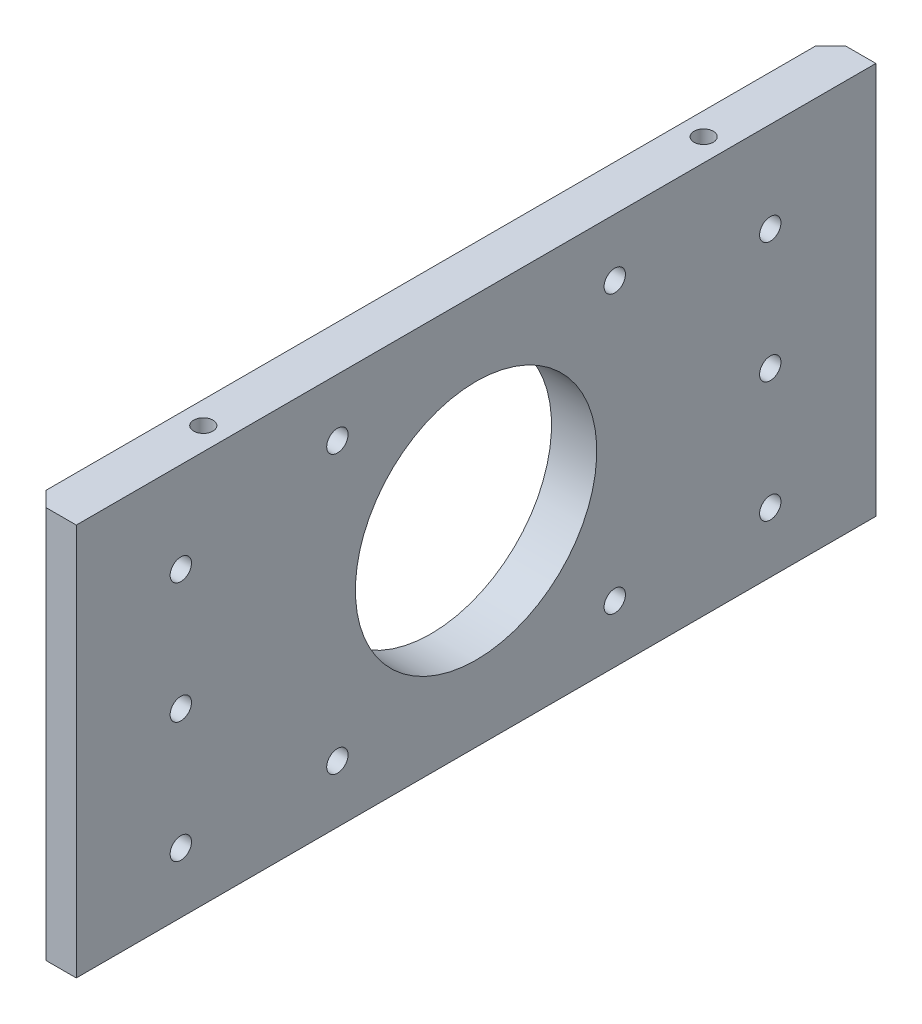
from build123d import *

# Parameters (mm, degrees)
SKETCH1_W                  = 9.525
SKETCH1_H                  = 82.55
BOSS_EXTRUDE1_DEPTH        = 168.275
F_8_CLEARANCE_HOLE1_D      = 4.4958
F_8_CLEARANCE_HOLE2_D      = 4.4958
SKETCH6_R                  = 25.4
CUT_EXTRUDE1_DEPTH         = 174.524715459
CIRPATTERN1_COUNT          = 4
CHAMFER1_SIZE              = 3.175
F_10_32_TAPPED_HOLE3_D     = 4.0386
F_10_32_TAPPED_HOLE3_DEPTH = 12.7
F_10_32_TAPPED_HOLE3_TIP   = 1.213317848
F_10_32_TAPPED_HOLE4_D     = 4.0386
F_10_32_TAPPED_HOLE4_DEPTH = 12.7
F_10_32_TAPPED_HOLE4_TIP   = 1.213317848


with BuildPart() as part:
    # Sketch1 → Boss-Extrude1 (new body)
    with BuildSketch(Plane.XY):
        Rectangle(SKETCH1_W, SKETCH1_H)
    extrude(amount=BOSS_EXTRUDE1_DEPTH)

    # #8 Clearance Hole1 (through all)
    with Locations(Plane(origin=(4.7625, 0, 0), x_dir=(0, 0, -1), z_dir=(1, 0, 0))):
        with Locations((-146.277954744, 22.225), (-146.277954744, -3.175), (-146.277954744, -28.575), (-22.225, 22.225), (-22.225, -3.175), (-22.225, -28.575)):
            Hole(F_8_CLEARANCE_HOLE1_D / 2)

    # #8 Clearance Hole2 (through all)
    with Locations(Plane(origin=(4.7625, 0, 0), x_dir=(0, 0, -1), z_dir=(1, 0, 0))):
        with Locations((-54.951667607, 29.185832393)):
            f_8_clearance_hole2 = Hole(F_8_CLEARANCE_HOLE2_D / 2)

    # Sketch6 → Cut-Extrude1 (cut, through all)
    with BuildSketch(Plane(origin=(4.7625, 0, 0), x_dir=(0, 0, -1), z_dir=(1, 0, 0))):
        with Locations((-84.1375, 0)):
            Circle(SKETCH6_R)
    extrude(amount=-CUT_EXTRUDE1_DEPTH, mode=Mode.SUBTRACT)

    # CirPattern1: #8 Clearance Hole2 ×4 about axis
    cirpattern1_axis = Axis((-4.7625, 0, 84.1375), (1, 0, 0))
    for i in range(1, CIRPATTERN1_COUNT):
        add(f_8_clearance_hole2.rotate(cirpattern1_axis, i * 360 / CIRPATTERN1_COUNT), mode=Mode.SUBTRACT)

    # Chamfer1
    chamfer1_edges = [part.edges().sort_by_distance(p)[0] for p in [
        (-4.7625, 0, 0),
        (-4.7625, 0, 168.275),
    ]]
    chamfer(chamfer1_edges, length=CHAMFER1_SIZE)

    # #10-32 Tapped Hole3
    with Locations(Plane(origin=(79.375, 41.275, 84.1375), x_dir=(1, 0, 0), z_dir=(0, 1, 0))):
        with Locations((-52.651418547, 79.375), (-79.375, -52.651418547), (-79.375, 52.651418547), (-52.651418547, -79.375), (52.651418547, -79.375), (79.375, 52.651418547), (79.375, -52.651418547), (52.651418547, 79.375)):
            Hole(F_10_32_TAPPED_HOLE3_D / 2, depth=F_10_32_TAPPED_HOLE3_DEPTH)
            with Locations((0, 0, -(F_10_32_TAPPED_HOLE3_DEPTH + F_10_32_TAPPED_HOLE3_TIP / 2))):  # 118° drill point
                Cone(0, F_10_32_TAPPED_HOLE3_D / 2, F_10_32_TAPPED_HOLE3_TIP, mode=Mode.SUBTRACT)

    # #10-32 Tapped Hole4
    with Locations(Plane(origin=(79.375, 41.275, 84.1375), x_dir=(-1, 0, 0), z_dir=(0, 1, 0))):
        with Locations((-52.651418547, 79.375), (-79.375, -52.651418547), (-79.375, 52.651418547), (-52.651418547, -79.375), (52.651418547, -79.375), (79.375, 52.651418547), (79.375, -52.651418547), (52.651418547, 79.375)):
            Hole(F_10_32_TAPPED_HOLE4_D / 2, depth=F_10_32_TAPPED_HOLE4_DEPTH)
            with Locations((0, 0, -(F_10_32_TAPPED_HOLE4_DEPTH + F_10_32_TAPPED_HOLE4_TIP / 2))):  # 118° drill point
                Cone(0, F_10_32_TAPPED_HOLE4_D / 2, F_10_32_TAPPED_HOLE4_TIP, mode=Mode.SUBTRACT)


solid = part.part
